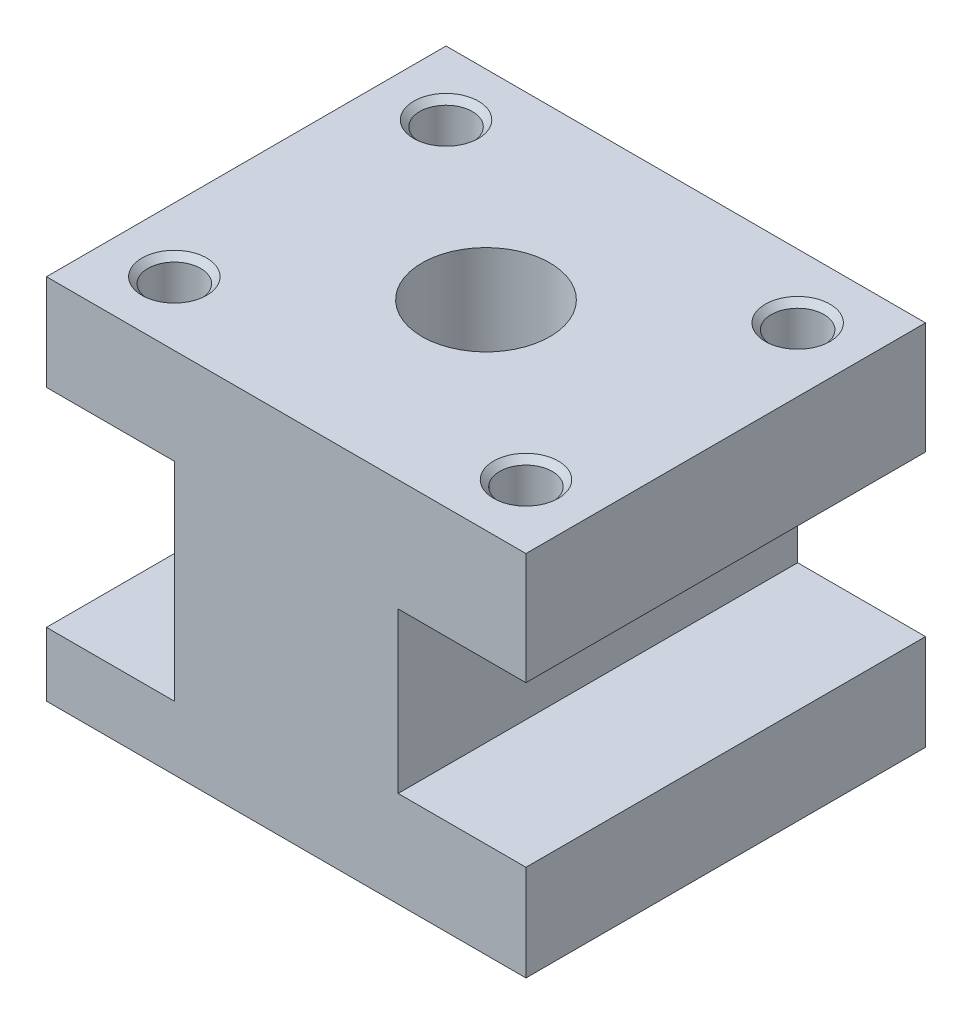
from build123d import *

# Parameters (mm, degrees)
RESSALTO_EXTRUS_O1_DEPTH = 12.5
F_8_0MM_DOWEL_HOLE1_D    = 8


# Read off the part's stored shape, not the designer's step: Furo roscado de M4x0.71
with BuildPart() as part:
    # Esboço1 → Ressalto-extrusão1 (new, symmetric)
    with BuildSketch(Plane.XY):
        Polygon((-15, 0), (15, 0), (15, 6), (7, 6), (7, 16), (15, 16), (15, 23), (-15, 23), (-15, 17), (-7, 17), (-7, 4), (-15, 4), align=None)
    extrude(amount=RESSALTO_EXTRUS_O1_DEPTH, both=True)

    # Furo roscado de M4x0.71 outline → Furo roscado de M4x0.71 (revolve, cut)
    with BuildSketch(Plane(origin=(11, 0, -8.5), x_dir=(1, 0, 0), z_dir=(0, 0, 1))):
        Polygon((0, 16), (1.65, 16), (1.65, 22.625), (2.025, 23), (0, 23), align=None)
    furo_roscado_de_m4x0_71 = revolve(axis=Axis((11, 0, -8.5), (0, 1, 0)), mode=Mode.SUBTRACT)

    # Furo roscado de M4x0.71 2 outline → Furo roscado de M4x0.71 2 (revolve, cut)
    with BuildSketch(Plane(origin=(-11, 0, -8.5), x_dir=(1, 0, 0), z_dir=(0, 0, 1))):
        Polygon((0, 17), (1.65, 17), (1.65, 22.625), (2.025, 23), (0, 23), align=None)
    furo_roscado_de_m4x0_71_2 = revolve(axis=Axis((-11, 0, -8.5), (0, 1, 0)), mode=Mode.SUBTRACT)

    # Espelhar1: Furo roscado de M4x0.71, Furo roscado de M4x0.71 2 across plane
    add(furo_roscado_de_m4x0_71.mirror(Plane.XY), mode=Mode.SUBTRACT)
    add(furo_roscado_de_m4x0_71_2.mirror(Plane.XY), mode=Mode.SUBTRACT)

    # Ø8.0mm Dowel Hole1 (through all)
    with Locations(Plane(origin=(0, 23, 0), x_dir=(1, 0, 0), z_dir=(0, 1, 0))):
        with Locations((0, 0)):
            Hole(F_8_0MM_DOWEL_HOLE1_D / 2)


solid = part.part
